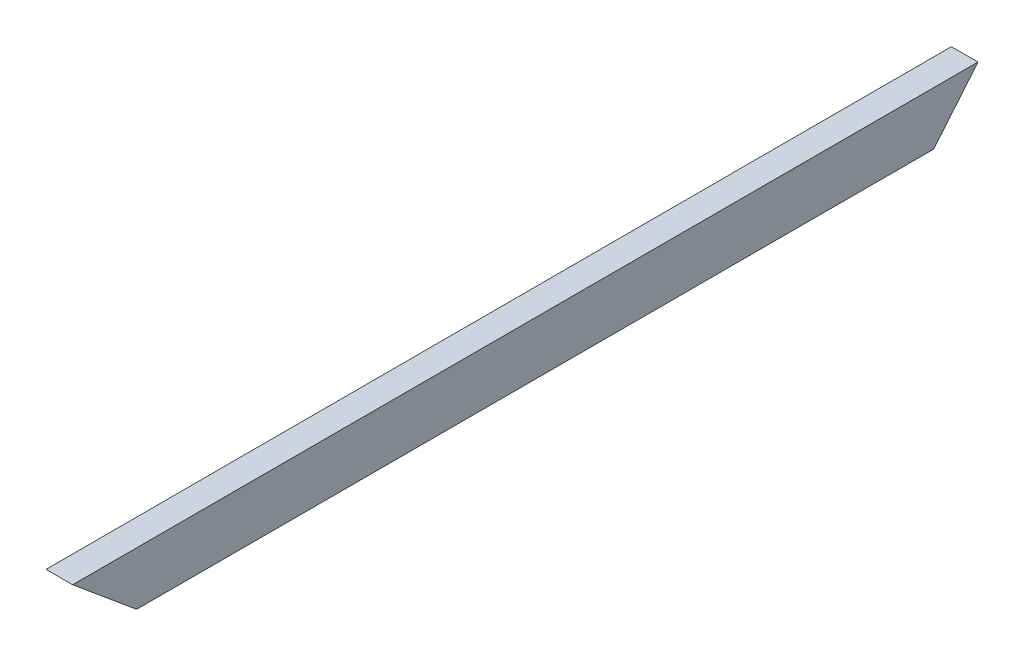
from build123d import *

# Parameters (mm, degrees)
SKETCH1_W           = 12.7
SKETCH1_H           = 25.4
SKETCH1_W_2         = 6.35
SKETCH1_H_2         = 19.05
BOSS_EXTRUDE1_DEPTH = 431.8
CUT_EXTRUDE1_DEPTH  = 433.73281595
CUT_EXTRUDE2_DEPTH  = 433.73281595


with BuildPart() as part:
    # Sketch1 → Boss-Extrude1 (new body)
    with BuildSketch(Plane.XY):
        with Locations((6.35, 12.7)):
            Rectangle(SKETCH1_W, SKETCH1_H)
        with Locations((6.35, 12.7)):
            Rectangle(SKETCH1_W_2, SKETCH1_H_2, mode=Mode.SUBTRACT)
    extrude(amount=BOSS_EXTRUDE1_DEPTH)

    # Sketch2 → Cut-Extrude1 (cut, through all)
    with BuildSketch(Plane(origin=(12.7, 0, 0), x_dir=(0, 0, -1), z_dir=(1, 0, 0))):
        Polygon((-431.8, 25.4), (-401.275136185, 0), (-431.8, 0), align=None)
    extrude(amount=-CUT_EXTRUDE1_DEPTH, mode=Mode.SUBTRACT)

    # Sketch3 → Cut-Extrude2 (cut, through all)
    with BuildSketch(Plane(origin=(12.7, 0, 0), x_dir=(0, 0, -1), z_dir=(1, 0, 0))):
        Polygon((-21.13555703, 0), (0, 25.4), (0, 0), align=None)
    extrude(amount=-CUT_EXTRUDE2_DEPTH, mode=Mode.SUBTRACT)


solid = part.part
